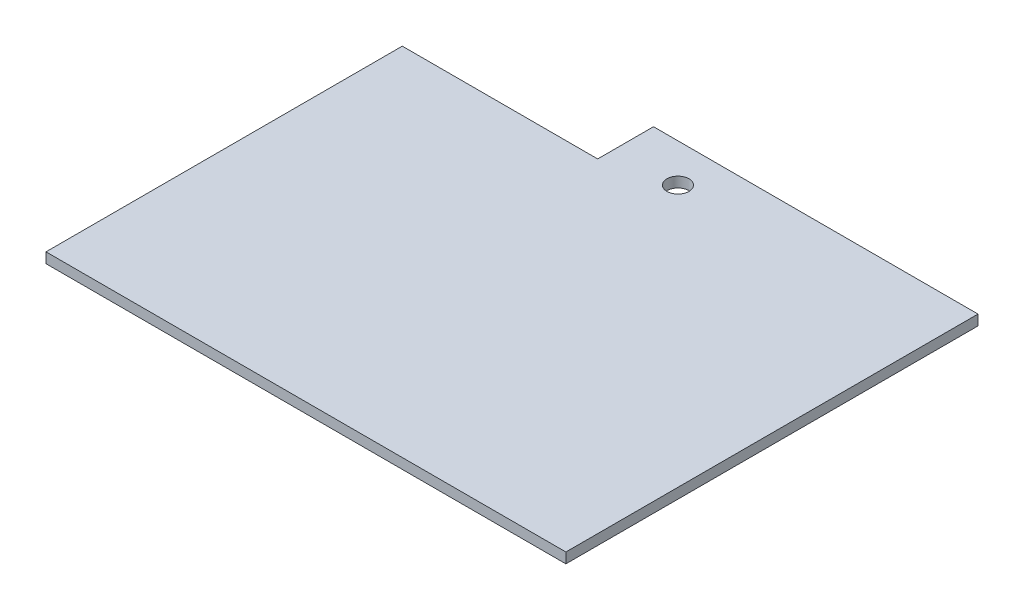
from build123d import *

# Parameters (mm, degrees)
SKETCH1_R           = 1.6
BOSS_EXTRUDE1_DEPTH = 1.5


with BuildPart() as part:
    # Sketch1 → Boss-Extrude1 (new body)
    with BuildSketch(Plane(origin=(0, 0, 0), x_dir=(1, 0, 0), z_dir=(0, 1, 0))):
        Polygon((37.845, -30), (37.845, 30), (-0.255, 30), (-8.731921414, 30), (-9.397, 30), (-9.397, 21.872), (-37.845, 21.872), (-37.845, -30), align=None)
        with Locations((-0.255, 24.42)):
            Circle(SKETCH1_R, mode=Mode.SUBTRACT)
    extrude(amount=BOSS_EXTRUDE1_DEPTH)


solid = part.part
